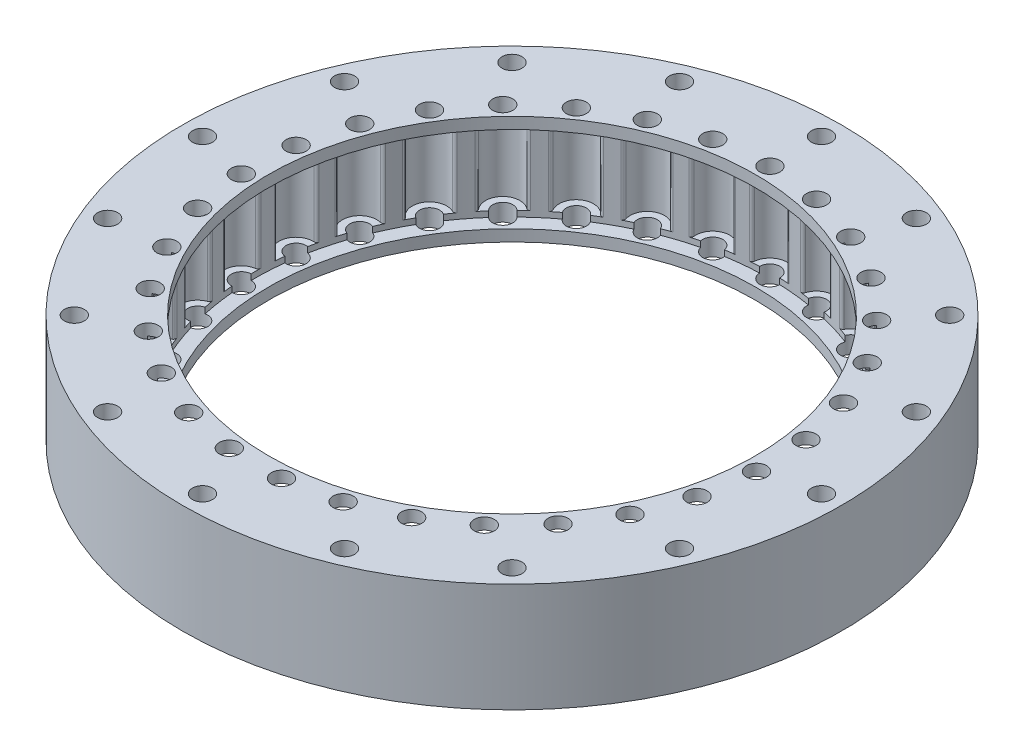
from build123d import *

# Parameters (mm, degrees)
SKETCH1_R                = 57.5
SKETCH1_R_2              = 45
BOSS_EXTRUDE1_DEPTH      = 13
BOSS_EXTRUDE2_START      = 1
SKETCH2_R                = 57.5
SKETCH2_R_2              = 45
BOSS_EXTRUDE2_DEPTH      = 1
BOSS_EXTRUDE3_START      = 2
SKETCH3_R                = 57.5
SKETCH3_R_2              = 42.5
BOSS_EXTRUDE3_DEPTH      = 2
SKETCH5_R                = 3
CUT_EXTRUDE2_DEPTH       = 13
FILLET4_R                = 0.5
SKETCH10_R               = 57.5
SKETCH10_R_2             = 45
BOSS_EXTRUDE4_DEPTH      = 1
SKETCH11_R               = 57.5
SKETCH11_R_2             = 42.5
BOSS_EXTRUDE5_DEPTH      = 2
SKETCH7_R                = 1.75
CUT_EXTRUDE3_DEPTH       = 23
CIRPATTERN3_COUNT        = 31
FILLET4_OF_CIRPATTERN3_R = 0.5
SKETCH4_R                = 1.75
CUT_EXTRUDE1_DEPTH       = 51


with BuildPart() as part:
    # Sketch1 → Boss-Extrude1 (new body)
    with BuildSketch(Plane(origin=(0, 0, 0), x_dir=(1, 0, 0), z_dir=(0, 1, 0))):
        Circle(SKETCH1_R)
        Circle(SKETCH1_R_2, mode=Mode.SUBTRACT)
    extrude(amount=BOSS_EXTRUDE1_DEPTH)

    # Sketch2 → Boss-Extrude2 (add)
    with BuildSketch(Plane.XZ.offset(BOSS_EXTRUDE2_START)):
        Circle(SKETCH2_R)
        Circle(SKETCH2_R_2, mode=Mode.SUBTRACT)
    extrude(amount=-BOSS_EXTRUDE2_DEPTH)

    # Sketch3 → Boss-Extrude3 (add)
    with BuildSketch(Plane.XZ.offset(1).offset(BOSS_EXTRUDE3_START)):
        Circle(SKETCH3_R)
        Circle(SKETCH3_R_2, mode=Mode.SUBTRACT)
    extrude(amount=-BOSS_EXTRUDE3_DEPTH)

    # Sketch5 → Cut-Extrude2 (cut)
    with BuildSketch(Plane(origin=(0, 13, 0), x_dir=(1, 0, 0), z_dir=(0, 1, 0))):
        with Locations((0, 45)):
            Circle(SKETCH5_R)
    cut_extrude2 = extrude(amount=-CUT_EXTRUDE2_DEPTH, mode=Mode.SUBTRACT)

    # Fillet4
    fillet4_edges = [part.edges().sort_by_distance(p)[0] for p in [
        (2.99833287, 6.5, -44.9),
        (-2.99833287, 6.5, -44.9),
    ]]
    fillet(fillet4_edges, radius=FILLET4_R)

    # Sketch10 → Boss-Extrude4 (add)
    with BuildSketch(Plane(origin=(0, 13, 0), x_dir=(1, 0, 0), z_dir=(0, 1, 0))):
        Circle(SKETCH10_R)
        Circle(SKETCH10_R_2, mode=Mode.SUBTRACT)
    extrude(amount=BOSS_EXTRUDE4_DEPTH)

    # Sketch11 → Boss-Extrude5 (add)
    with BuildSketch(Plane(origin=(0, 14, 0), x_dir=(1, 0, 0), z_dir=(0, 1, 0))):
        Circle(SKETCH11_R)
        Circle(SKETCH11_R_2, mode=Mode.SUBTRACT)
    extrude(amount=BOSS_EXTRUDE5_DEPTH)

    # Sketch7 → Cut-Extrude3 (cut)
    with BuildSketch(Plane(origin=(0, 16, 0), x_dir=(1, 0, 0), z_dir=(0, 1, 0))):
        with Locations((0, 45)):
            Circle(SKETCH7_R)
    cut_extrude3 = extrude(amount=-CUT_EXTRUDE3_DEPTH, mode=Mode.SUBTRACT)

    # CirPattern3: Cut-Extrude2, Cut-Extrude3 ×31 about axis
    cirpattern3_axis = Axis((0, -3, 0), (0, 1, 0))
    add([cut_extrude2.rotate(cirpattern3_axis, i * 360 / CIRPATTERN3_COUNT) for i in range(1, CIRPATTERN3_COUNT)], mode=Mode.SUBTRACT)
    add([cut_extrude3.rotate(cirpattern3_axis, i * 360 / CIRPATTERN3_COUNT) for i in range(1, CIRPATTERN3_COUNT)], mode=Mode.SUBTRACT)

    # Fillet4 of CirPattern3
    fillet4_of_cirpattern3_edges = [part.edges().sort_by_distance(p)[0] for p in [
        (-6.101346732, 6.5, -44.584454332),
        (-11.975260372, 6.5, -43.377334393),
        (-14.951236482, 6.5, -42.443615865),
        (-20.461919307, 6.5, -40.078795619),
        (-23.189020853, 6.5, -38.565130777),
        (-28.110864862, 6.5, -35.139426243),
        (-30.477443987, 6.5, -33.107784704),
        (-34.608948306, 6.5, -28.761444629),
        (-36.518116982, 6.5, -26.295002036),
        (-39.690137341, 6.5, -21.205966091),
        (-41.063733978, 6.5, -18.405698895),
        (-43.146407489, 6.5, -12.782312811),
        (-43.92819688, 6.5, -9.762864278),
        (-44.836258645, 6.5, -3.835350142),
        (-44.99423424, 6.5, -0.720336851),
        (-44.690508104, 6.5, 5.268632212),
        (-44.218202364, 6.5, 8.351681252),
        (-42.715122911, 6.5, 14.156916145),
        (-41.631872087, 6.5, 17.081780543),
        (-38.990975566, 6.5, 22.465614267),
        (-37.341128076, 6.5, 25.112549731),
        (-33.670533101, 6.5, 29.854567501),
        (-31.521633894, 6.5, 32.115208183),
        (-26.971615054, 6.5, 36.021271235),
        (-24.411640317, 6.5, 37.803066239),
        (-19.168475919, 6.5, 40.713259891),
        (-16.302231317, 6.5, 41.943262321),
        (-10.580577126, 6.5, 43.738442904),
        (-7.525407051, 6.5, 44.366296315),
        (-1.559508263, 6.5, 44.972968926),
        (1.559508263, 6.5, 44.972968926),
        (7.525407051, 6.5, 44.366296315),
        (10.580577126, 6.5, 43.738442904),
        (16.302231317, 6.5, 41.943262321),
        (19.168475919, 6.5, 40.713259891),
        (24.411640317, 6.5, 37.803066239),
        (26.971615054, 6.5, 36.021271235),
        (31.521633894, 6.5, 32.115208183),
        (33.670533101, 6.5, 29.854567501),
        (37.341128076, 6.5, 25.112549731),
        (38.990975566, 6.5, 22.465614267),
        (41.631872087, 6.5, 17.081780543),
        (42.715122911, 6.5, 14.156916145),
        (44.218202364, 6.5, 8.351681252),
        (44.690508104, 6.5, 5.268632212),
        (44.99423424, 6.5, -0.720336851),
        (44.836258645, 6.5, -3.835350142),
        (43.92819688, 6.5, -9.762864278),
        (43.146407489, 6.5, -12.782312811),
        (41.063733978, 6.5, -18.405698895),
        (39.690137341, 6.5, -21.205966091),
        (36.518116982, 6.5, -26.295002036),
        (34.608948306, 6.5, -28.761444629),
        (30.477443987, 6.5, -33.107784704),
        (28.110864862, 6.5, -35.139426243),
        (23.189020853, 6.5, -38.565130777),
        (20.461919307, 6.5, -40.078795619),
        (14.951236482, 6.5, -42.443615865),
        (11.975260372, 6.5, -43.377334393),
        (6.101346732, 6.5, -44.584454332),
    ]]
    fillet(fillet4_of_cirpattern3_edges, radius=FILLET4_OF_CIRPATTERN3_R)

    # Sketch4 → Cut-Extrude1 (cut)
    with BuildSketch(Plane(origin=(0, 16, 0), x_dir=(1, 0, 0), z_dir=(0, 1, 0))):
        with Locations((0, 54)):
            Circle(SKETCH4_R)
        with Locations((20.664905348, 49.889494756)):
            Circle(SKETCH4_R)
        with Locations((38.183766184, 38.183766184)):
            Circle(SKETCH4_R)
        with Locations((49.889494756, 20.664905348)):
            Circle(SKETCH4_R)
        with Locations((54, 0)):
            Circle(SKETCH4_R)
        with Locations((49.889494756, -20.664905348)):
            Circle(SKETCH4_R)
        with Locations((38.183766184, -38.183766184)):
            Circle(SKETCH4_R)
        with Locations((20.664905348, -49.889494756)):
            Circle(SKETCH4_R)
        with Locations((0, -54)):
            Circle(SKETCH4_R)
        with Locations((-20.664905348, -49.889494756)):
            Circle(SKETCH4_R)
        with Locations((-38.183766184, -38.183766184)):
            Circle(SKETCH4_R)
        with Locations((-49.889494756, -20.664905348)):
            Circle(SKETCH4_R)
        with Locations((-54, 0)):
            Circle(SKETCH4_R)
        with Locations((-49.889494756, 20.664905348)):
            Circle(SKETCH4_R)
        with Locations((-38.183766184, 38.183766184)):
            Circle(SKETCH4_R)
        with Locations((-20.664905348, 49.889494756)):
            Circle(SKETCH4_R)
    extrude(amount=-CUT_EXTRUDE1_DEPTH, mode=Mode.SUBTRACT)


solid = part.part
